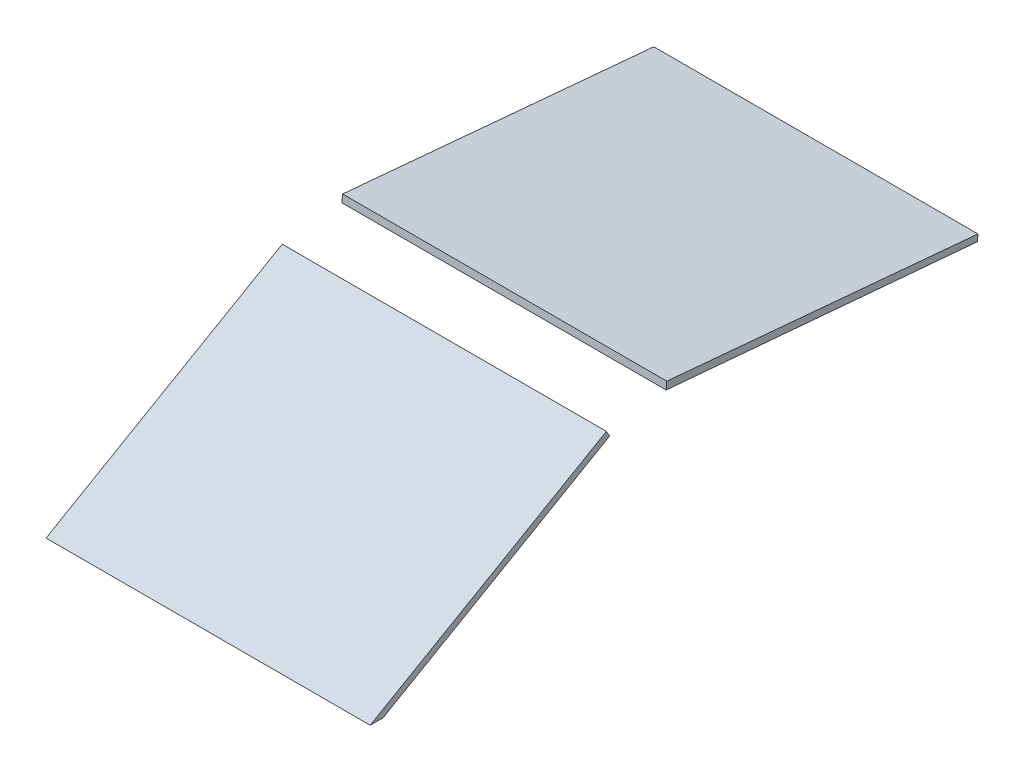
from build123d import *

# Parameters (mm, degrees)
BOSS_EXTRUDE1_DEPTH = 150
CUT_EXTRUDE1_DEPTH  = 322.300291598


with BuildPart() as part:
    # Sketch1 → Boss-Extrude1 (new body)
    with BuildSketch(Plane(origin=(0, 0, 0), x_dir=(0, 0, -1), z_dir=(1, 0, 0))):
        Polygon((0, 0), (116.28989122, 67.14), (274.963782732, 53.257833295), (275.22524996, 56.246417389), (116.28989122, 70.604101615), (-6, 0), align=None)
    extrude(amount=BOSS_EXTRUDE1_DEPTH)

    # Sketch4 → Cut-Extrude1 (cut, through all)
    with BuildSketch(Plane(origin=(150, 0, 0), x_dir=(0, 0, -1), z_dir=(1, 0, 0))):
        Polygon((103.299510163, 63.104101615), (104.799510163, 60.506025404), (116.28989122, 67.14), (130.931984572, 65.858982821), (131.229058003, 69.254547677), (116.28989122, 70.604101615), align=None)
    extrude(amount=-CUT_EXTRUDE1_DEPTH, mode=Mode.SUBTRACT)


with BuildPart() as cut_extrude1_piece_1:
    # of the separate pieces the step leaves, piece 1, a body of its own (cut_extrude1_pieces)
    add(part.part.solids().sort_by_distance((0, 65.858982821, -130.931984572))[0])


with BuildPart() as cut_extrude1_piece_2:
    # of the separate pieces the step leaves, piece 2, a body of its own (cut_extrude1_pieces)
    add(part.part.solids().sort_by_distance((0, 0, 0))[0])


solid = Compound([cut_extrude1_piece_1.part, cut_extrude1_piece_2.part])
